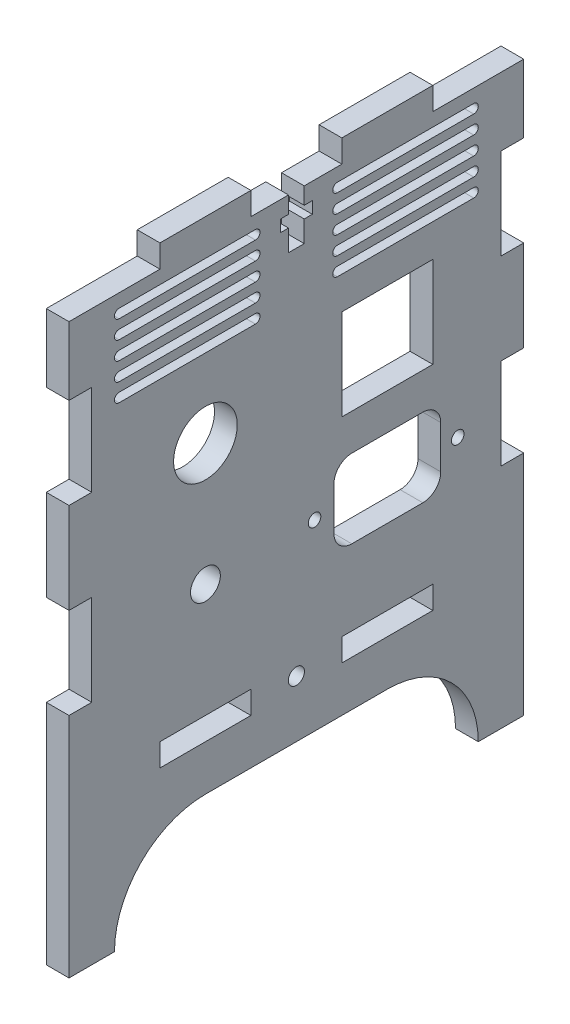
from build123d import *

# Parameters (mm, degrees)
SKETCH1_W                 = 127
SKETCH1_H                 = 165.1
BOSS_EXTRUDE1_DEPTH       = 6.35
SKETCH2_W                 = 25.4
SKETCH2_H                 = 6.35
CUT_EXTRUDE1_DEPTH        = 6.35
LPATTERN1_COUNT           = 3
LPATTERN1_PITCH           = 50.8
CUT_EXTRUDE4_DEPTH        = 6.35
SKETCH8_W                 = 6.35
SKETCH8_H                 = 25.4
CUT_EXTRUDE6_DEPTH        = 6.35
LPATTERN4_COUNT           = 2
LPATTERN4_PITCH           = 50.8
MIRROR1_COPY_1_SKETCH_W   = 6.35
MIRROR1_COPY_1_SKETCH_H   = 25.4
MIRROR1_COPY_1_DEPTH      = 6.35
MIRROR1_COPY_2_SKETCH_W   = 6.35
MIRROR1_COPY_2_SKETCH_H   = 25.4
MIRROR1_COPY_2_DEPTH      = 6.35
SKETCH9_W                 = 25.4
SKETCH9_H                 = 6.35
CUT_EXTRUDE7_DEPTH        = 6.35
LPATTERN6_COUNT           = 2
LPATTERN6_PITCH           = 50.8
SKETCH16_W                = 4.3942
SKETCH16_H                = 13.97
SKETCH16_W_2              = 8.89
SKETCH16_H_2              = 3.302
CUT_EXTRUDE14_DEPTH       = 6.35
F_8_CLEARANCE_HOLE1_D     = 4.4958
F_8_CLEARANCE_HOLE1_DEPTH = 10.16
F_8_CLEARANCE_HOLE1_TIP   = 1.350674586
CUT_EXTRUDE15_DEPTH       = 6.35
LPATTERN7_COPY_1_DEPTH    = 6.35
LPATTERN7_COPY_2_DEPTH    = 6.35
LPATTERN7_COPY_3_DEPTH    = 6.35
LPATTERN7_COPY_4_DEPTH    = 6.35
LPATTERN7_COPY_5_DEPTH    = 6.35
LPATTERN7_COPY_6_DEPTH    = 6.35
LPATTERN7_COPY_7_DEPTH    = 6.35
LPATTERN7_COPY_8_DEPTH    = 6.35
SKETCH20_R                = 1.75
CUT_EXTRUDE16_DEPTH       = 7.62
SKETCH22_W                = 25.4
SKETCH22_H                = 25.4
CUT_EXTRUDE17_DEPTH       = 6.35
SKETCH23_R                = 8.89
CUT_EXTRUDE18_DEPTH       = 7.62
SKETCH24_R                = 4.1671875
CUT_EXTRUDE19_DEPTH       = 7.62


with BuildPart() as part:
    # Sketch1 → Boss-Extrude1 (new body)
    with BuildSketch(Plane(origin=(0, 0, 0), x_dir=(0, 0, -1), z_dir=(1, 0, 0))):
        Rectangle(SKETCH1_W, SKETCH1_H)
    extrude(amount=BOSS_EXTRUDE1_DEPTH)

    # Sketch2 → Cut-Extrude1 (cut)
    with BuildSketch(Plane(origin=(6.35, 0, 0), x_dir=(0, 0, -1), z_dir=(1, 0, 0))):
        with Locations((-50.8, 79.375)):
            Rectangle(SKETCH2_W, SKETCH2_H)
    cut_extrude1 = extrude(amount=-CUT_EXTRUDE1_DEPTH, mode=Mode.SUBTRACT)

    # LPattern1: Cut-Extrude1 ×3
    with Locations(*[(0, 0, -i * LPATTERN1_PITCH) for i in range(1, LPATTERN1_COUNT)]):
        add(cut_extrude1, mode=Mode.SUBTRACT)

    # Sketch5 → Cut-Extrude4 (cut)
    with BuildSketch(Plane(origin=(6.35, 0, 0), x_dir=(0, 0, -1), z_dir=(1, 0, 0))):
        with BuildLine():
            Line((-25.4, -57.15), (25.4, -57.15))
            ThreePointArc((25.4, -57.15), (50.8, -82.55), (25.4, -107.95))
            Line((25.4, -107.95), (-25.4, -107.95))
            ThreePointArc((-25.4, -107.95), (-50.8, -82.55), (-25.4, -57.15))
        make_face()
    extrude(amount=-CUT_EXTRUDE4_DEPTH, mode=Mode.SUBTRACT)

    # Sketch8 → Cut-Extrude6 (cut)
    with BuildSketch(Plane(origin=(6.35, 0, 0), x_dir=(0, 0, -1), z_dir=(1, 0, 0))):
        with Locations((60.325, 44.45)):
            Rectangle(SKETCH8_W, SKETCH8_H)
    cut_extrude6 = extrude(amount=-CUT_EXTRUDE6_DEPTH, mode=Mode.SUBTRACT)

    # LPattern4: Cut-Extrude6 ×2
    with Locations(*[(0, -i * LPATTERN4_PITCH, 0) for i in range(1, LPATTERN4_COUNT)]):
        add(cut_extrude6, mode=Mode.SUBTRACT)

    # Mirror1 copy 1 sketch → Mirror1 copy 1 (cut)
    with BuildSketch(Plane(origin=(6.35, -50.8, 0), x_dir=(0, 0, 1), z_dir=(1, 0, 0))):
        with Locations((60.325, -44.45)):
            Rectangle(MIRROR1_COPY_1_SKETCH_W, MIRROR1_COPY_1_SKETCH_H)
    extrude(amount=-MIRROR1_COPY_1_DEPTH, mode=Mode.SUBTRACT)

    # Mirror1 copy 2 sketch → Mirror1 copy 2 (cut)
    with BuildSketch(Plane(origin=(6.35, 0, 0), x_dir=(0, 0, 1), z_dir=(1, 0, 0))):
        with Locations((60.325, -44.45)):
            Rectangle(MIRROR1_COPY_2_SKETCH_W, MIRROR1_COPY_2_SKETCH_H)
    extrude(amount=-MIRROR1_COPY_2_DEPTH, mode=Mode.SUBTRACT)

    # Sketch9 → Cut-Extrude7 (cut)
    with BuildSketch(Plane.ZY):
        with Locations((-25.4, -41.275)):
            Rectangle(SKETCH9_W, SKETCH9_H)
    cut_extrude7 = extrude(amount=-CUT_EXTRUDE7_DEPTH, mode=Mode.SUBTRACT)

    # LPattern6: Cut-Extrude7 ×2
    with Locations(*[(0, 0, i * LPATTERN6_PITCH) for i in range(1, LPATTERN6_COUNT)]):
        add(cut_extrude7, mode=Mode.SUBTRACT)

    # Sketch16 → Cut-Extrude14 (cut)
    with BuildSketch(Plane.ZY):
        with Locations((0, 69.215)):
            Rectangle(SKETCH16_W, SKETCH16_H)
        with Locations((0, 69.85)):
            Rectangle(SKETCH16_W_2, SKETCH16_H_2)
    extrude(amount=-CUT_EXTRUDE14_DEPTH, mode=Mode.SUBTRACT)

    # #8 Clearance Hole1
    with Locations(Plane.ZY):
        with Locations((0, -41.275)):
            Hole(F_8_CLEARANCE_HOLE1_D / 2, depth=F_8_CLEARANCE_HOLE1_DEPTH)
            with Locations((0, 0, -(F_8_CLEARANCE_HOLE1_DEPTH + F_8_CLEARANCE_HOLE1_TIP / 2))):  # 118° drill point
                Cone(0, F_8_CLEARANCE_HOLE1_D / 2, F_8_CLEARANCE_HOLE1_TIP, mode=Mode.SUBTRACT)

    # Sketch19 → Cut-Extrude15 (cut)
    with BuildSketch(Plane.ZY):
        with BuildLine():
            Line((-49.53, 72.448860523), (-11.43, 72.448860523))
            ThreePointArc((-11.43, 72.448860523), (-10.16, 71.178860523), (-11.43, 69.908860523))
            Line((-11.43, 69.908860523), (-49.53, 69.908860523))
            ThreePointArc((-49.53, 69.908860523), (-50.8, 71.178860523), (-49.53, 72.448860523))
        make_face()
    cut_extrude15 = extrude(amount=-CUT_EXTRUDE15_DEPTH, mode=Mode.SUBTRACT)

    # Mirror2: Cut-Extrude15 across plane
    add(cut_extrude15.mirror(Plane.XY), mode=Mode.SUBTRACT)

    # LPattern7 copy 1 sketch → LPattern7 copy 1 (cut)
    with BuildSketch(Plane(origin=(0, -5.08, 0), x_dir=(0, 0, -1), z_dir=(-1, 0, 0))):
        with BuildLine():
            Line((-49.53, -72.448860523), (-11.43, -72.448860523))
            ThreePointArc((-11.43, -72.448860523), (-10.16, -71.178860523), (-11.43, -69.908860523))
            Line((-11.43, -69.908860523), (-49.53, -69.908860523))
            ThreePointArc((-49.53, -69.908860523), (-50.8, -71.178860523), (-49.53, -72.448860523))
        make_face()
    extrude(amount=-LPATTERN7_COPY_1_DEPTH, mode=Mode.SUBTRACT)

    # LPattern7 copy 2 sketch → LPattern7 copy 2 (cut)
    with BuildSketch(Plane(origin=(0, -10.16, 0), x_dir=(0, 0, -1), z_dir=(-1, 0, 0))):
        with BuildLine():
            Line((-49.53, -72.448860523), (-11.43, -72.448860523))
            ThreePointArc((-11.43, -72.448860523), (-10.16, -71.178860523), (-11.43, -69.908860523))
            Line((-11.43, -69.908860523), (-49.53, -69.908860523))
            ThreePointArc((-49.53, -69.908860523), (-50.8, -71.178860523), (-49.53, -72.448860523))
        make_face()
    extrude(amount=-LPATTERN7_COPY_2_DEPTH, mode=Mode.SUBTRACT)

    # LPattern7 copy 3 sketch → LPattern7 copy 3 (cut)
    with BuildSketch(Plane(origin=(0, -15.24, 0), x_dir=(0, 0, -1), z_dir=(-1, 0, 0))):
        with BuildLine():
            Line((-49.53, -72.448860523), (-11.43, -72.448860523))
            ThreePointArc((-11.43, -72.448860523), (-10.16, -71.178860523), (-11.43, -69.908860523))
            Line((-11.43, -69.908860523), (-49.53, -69.908860523))
            ThreePointArc((-49.53, -69.908860523), (-50.8, -71.178860523), (-49.53, -72.448860523))
        make_face()
    extrude(amount=-LPATTERN7_COPY_3_DEPTH, mode=Mode.SUBTRACT)

    # LPattern7 copy 4 sketch → LPattern7 copy 4 (cut)
    with BuildSketch(Plane(origin=(0, -20.32, 0), x_dir=(0, 0, -1), z_dir=(-1, 0, 0))):
        with BuildLine():
            Line((-49.53, -72.448860523), (-11.43, -72.448860523))
            ThreePointArc((-11.43, -72.448860523), (-10.16, -71.178860523), (-11.43, -69.908860523))
            Line((-11.43, -69.908860523), (-49.53, -69.908860523))
            ThreePointArc((-49.53, -69.908860523), (-50.8, -71.178860523), (-49.53, -72.448860523))
        make_face()
    extrude(amount=-LPATTERN7_COPY_4_DEPTH, mode=Mode.SUBTRACT)

    # LPattern7 copy 5 sketch → LPattern7 copy 5 (cut)
    with BuildSketch(Plane(origin=(0, -5.08, 0), x_dir=(0, 0, 1), z_dir=(-1, 0, 0))):
        with BuildLine():
            Line((-49.53, 72.448860523), (-11.43, 72.448860523))
            ThreePointArc((-11.43, 72.448860523), (-10.16, 71.178860523), (-11.43, 69.908860523))
            Line((-11.43, 69.908860523), (-49.53, 69.908860523))
            ThreePointArc((-49.53, 69.908860523), (-50.8, 71.178860523), (-49.53, 72.448860523))
        make_face()
    extrude(amount=-LPATTERN7_COPY_5_DEPTH, mode=Mode.SUBTRACT)

    # LPattern7 copy 6 sketch → LPattern7 copy 6 (cut)
    with BuildSketch(Plane(origin=(0, -10.16, 0), x_dir=(0, 0, 1), z_dir=(-1, 0, 0))):
        with BuildLine():
            Line((-49.53, 72.448860523), (-11.43, 72.448860523))
            ThreePointArc((-11.43, 72.448860523), (-10.16, 71.178860523), (-11.43, 69.908860523))
            Line((-11.43, 69.908860523), (-49.53, 69.908860523))
            ThreePointArc((-49.53, 69.908860523), (-50.8, 71.178860523), (-49.53, 72.448860523))
        make_face()
    extrude(amount=-LPATTERN7_COPY_6_DEPTH, mode=Mode.SUBTRACT)

    # LPattern7 copy 7 sketch → LPattern7 copy 7 (cut)
    with BuildSketch(Plane(origin=(0, -15.24, 0), x_dir=(0, 0, 1), z_dir=(-1, 0, 0))):
        with BuildLine():
            Line((-49.53, 72.448860523), (-11.43, 72.448860523))
            ThreePointArc((-11.43, 72.448860523), (-10.16, 71.178860523), (-11.43, 69.908860523))
            Line((-11.43, 69.908860523), (-49.53, 69.908860523))
            ThreePointArc((-49.53, 69.908860523), (-50.8, 71.178860523), (-49.53, 72.448860523))
        make_face()
    extrude(amount=-LPATTERN7_COPY_7_DEPTH, mode=Mode.SUBTRACT)

    # LPattern7 copy 8 sketch → LPattern7 copy 8 (cut)
    with BuildSketch(Plane(origin=(0, -20.32, 0), x_dir=(0, 0, 1), z_dir=(-1, 0, 0))):
        with BuildLine():
            Line((-49.53, 72.448860523), (-11.43, 72.448860523))
            ThreePointArc((-11.43, 72.448860523), (-10.16, 71.178860523), (-11.43, 69.908860523))
            Line((-11.43, 69.908860523), (-49.53, 69.908860523))
            ThreePointArc((-49.53, 69.908860523), (-50.8, 71.178860523), (-49.53, 72.448860523))
        make_face()
    extrude(amount=-LPATTERN7_COPY_8_DEPTH, mode=Mode.SUBTRACT)

    # Sketch20 → Cut-Extrude16 (cut)
    with BuildSketch(Plane.ZY):
        with Locations((-45.0725, -6.0601)):
            Circle(SKETCH20_R)
        with Locations((-5.0725, -6.0601)):
            Circle(SKETCH20_R)
        with BuildLine():
            Line((-35.3225, 4.9), (-15.4775, 4.9))
            ThreePointArc((-15.4775, 4.9), (-11.941966094, 3.435533906), (-10.4775, -0.1))
            Line((-10.4775, -0.1), (-10.4775, -12.0202))
            ThreePointArc((-10.4775, -12.0202), (-11.941966094, -15.555733906), (-15.4775, -17.0202))
            Line((-15.4775, -17.0202), (-35.3225, -17.0202))
            ThreePointArc((-35.3225, -17.0202), (-38.858033906, -15.555733906), (-40.3225, -12.0202))
            Line((-40.3225, -12.0202), (-40.3225, -0.1))
            ThreePointArc((-40.3225, -0.1), (-38.858033906, 3.435533906), (-35.3225, 4.9))
        make_face()
    extrude(amount=-CUT_EXTRUDE16_DEPTH, mode=Mode.SUBTRACT)

    # Sketch22 → Cut-Extrude17 (cut)
    with BuildSketch(Plane.ZY):
        with Locations((-25.4, 27.76)):
            Rectangle(SKETCH22_W, SKETCH22_H)
    extrude(amount=-CUT_EXTRUDE17_DEPTH, mode=Mode.SUBTRACT)

    # Sketch23 → Cut-Extrude18 (cut)
    with BuildSketch(Plane.ZY):
        with Locations((25.4, 27.76)):
            Circle(SKETCH23_R)
    extrude(amount=-CUT_EXTRUDE18_DEPTH, mode=Mode.SUBTRACT)

    # Sketch24 → Cut-Extrude19 (cut)
    with BuildSketch(Plane.ZY):
        with Locations((25.4, -6.35)):
            Circle(SKETCH24_R)
    extrude(amount=-CUT_EXTRUDE19_DEPTH, mode=Mode.SUBTRACT)


solid = part.part
